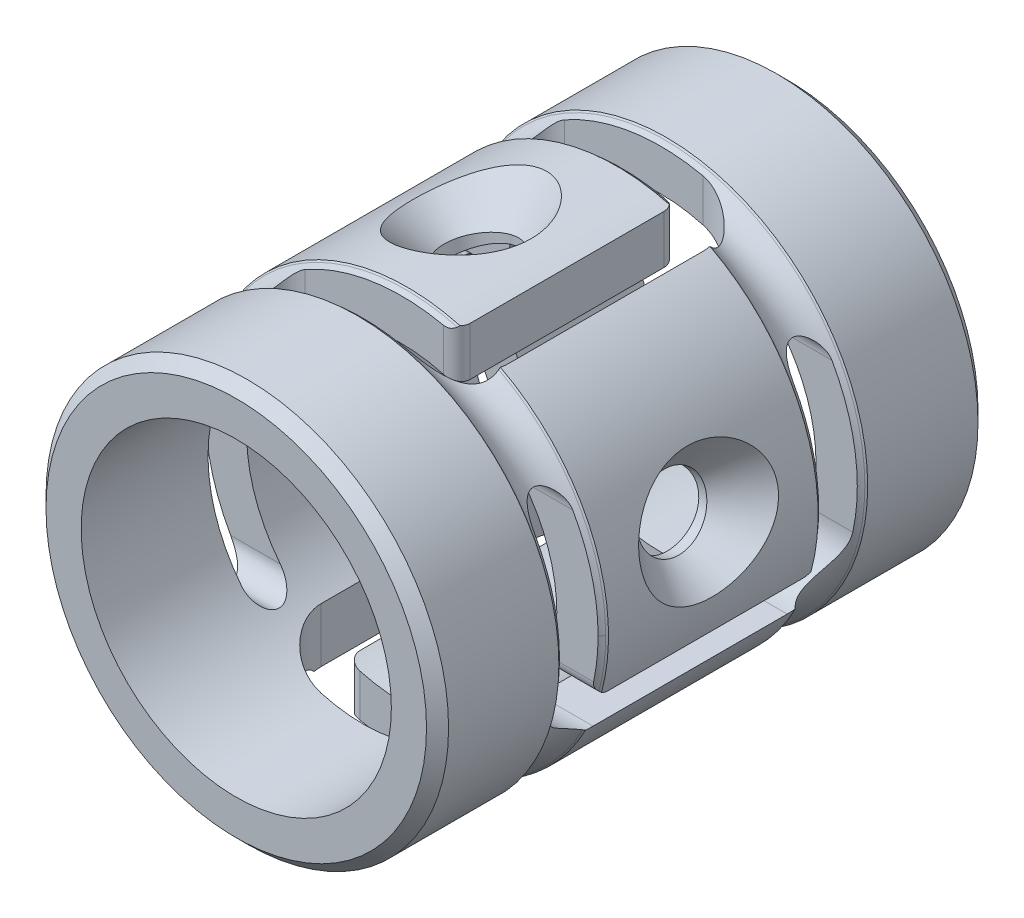
from build123d import *

# Parameters (mm, degrees)
CUT_EXTRUDE2_DEPTH = 5.08
CIRPATTERN2_COUNT  = 4


with BuildPart() as part:
    # Sketch1 → Revolve1 (revolve)
    with BuildSketch(Plane(origin=(0, 0, 0), x_dir=(0, 0, -1), z_dir=(1, 0, 0))):
        with BuildLine():
            Line((6.35, 4.3815), (6.35, 3.571875))
            Line((6.35, 3.571875), (-6.35, 3.571875))
            Line((-6.35, 3.571875), (-6.35, 4.3815))
            Line((-6.35, 4.3815), (-6.096, 4.6355))
            Line((-6.096, 4.6355), (-3.556, 4.6355))
            Line((-3.556, 4.6355), (-3.523315367, 4.602815367))
            ThreePointArc((-3.523315367, 4.602815367), (-2.9845, 4.379630735), (-2.445684633, 4.602815367))
            Line((-2.445684633, 4.602815367), (-2.413, 4.6355))
            Line((-2.413, 4.6355), (2.413, 4.6355))
            Line((2.413, 4.6355), (2.445684633, 4.602815367))
            ThreePointArc((2.445684633, 4.602815367), (2.9845, 4.379630735), (3.523315367, 4.602815367))
            Line((3.523315367, 4.602815367), (3.556, 4.6355))
            Line((3.556, 4.6355), (6.096, 4.6355))
            Line((6.096, 4.6355), (6.35, 4.3815))
        make_face()
    revolve(axis=Axis((0, 0, -2.501434457), (0, 0, -1)))

    # Sketch6 → Cut-Revolve2 (revolve, cut)
    with BuildSketch(Plane.XY):
        Polygon((-1.056191389, 4.968989812), (0.883478885, 5.381279456), (-0.00517697, 3.842082365), (0.375688579, 2.050250837), (-0.400716079, 1.885220933), align=None)
    cut_revolve2 = revolve(axis=Axis((-1.056191389, 4.968989812, 0), (-0.20791169081776004, 0.9781476007338055, 0)), mode=Mode.SUBTRACT)

    # Sketch5 → Cut-Extrude2 (cut)
    with BuildSketch(Plane.XZ.offset(-1.8796)):
        with BuildLine():
            Line((-2.2225, 2.54), (0.9652, 2.54))
            ThreePointArc((0.9652, 2.54), (1.180726147, 2.450726147), (1.27, 2.2352))
            Line((1.27, 2.2352), (1.27, -2.2352))
            ThreePointArc((1.27, -2.2352), (1.180726147, -2.450726147), (0.9652, -2.54))
            Line((0.9652, -2.54), (-2.2225, -2.54))
            ThreePointArc((-2.2225, -2.54), (-2.667, -2.9845), (-2.2225, -3.429))
            Line((-2.2225, -3.429), (0.9652, -3.429))
            ThreePointArc((0.9652, -3.429), (1.809344075, -3.079344075), (2.159, -2.2352))
            Line((2.159, -2.2352), (2.159, 2.2352))
            ThreePointArc((2.159, 2.2352), (1.809344075, 3.079344075), (0.9652, 3.429))
            Line((0.9652, 3.429), (-2.2225, 3.429))
            ThreePointArc((-2.2225, 3.429), (-2.667, 2.9845), (-2.2225, 2.54))
        make_face()
    cut_extrude2 = extrude(amount=-CUT_EXTRUDE2_DEPTH, mode=Mode.SUBTRACT)

    # CirPattern2: Cut-Revolve2, Cut-Extrude2 ×4 about axis
    cirpattern2_axis = Axis((0, 0, -15.039939146), (0, 0, 1))
    add([cut_revolve2.rotate(cirpattern2_axis, i * 360 / CIRPATTERN2_COUNT) for i in range(1, CIRPATTERN2_COUNT)], mode=Mode.SUBTRACT)
    add([cut_extrude2.rotate(cirpattern2_axis, i * 360 / CIRPATTERN2_COUNT) for i in range(1, CIRPATTERN2_COUNT)], mode=Mode.SUBTRACT)


solid = part.part
